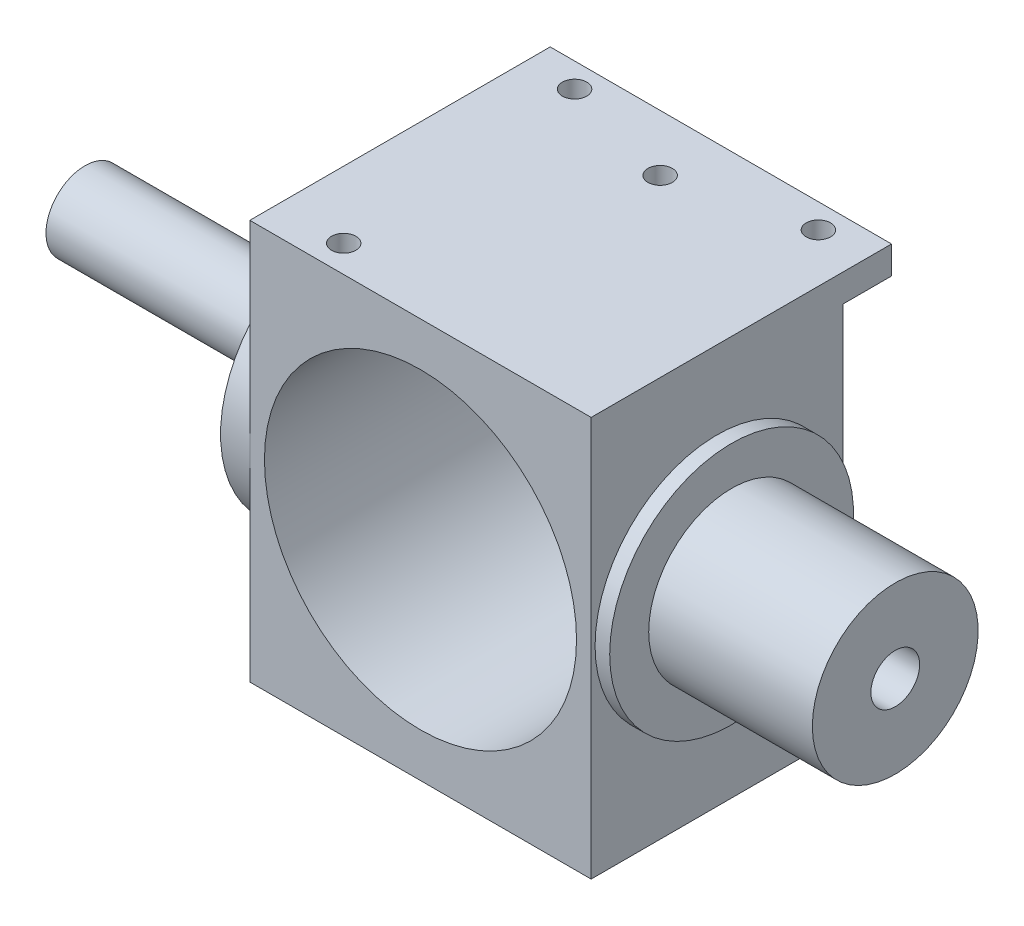
from build123d import *

# Parameters (mm, degrees)
SKETCH24_W                     = 35
SKETCH24_H                     = 41
BOSS_EXTRUDE2_DEPTH            = 30.8
SKETCH30_W                     = 5
SKETCH30_H                     = 35.1536
CUT_EXTRUDE2_DEPTH             = 96.268509944
SKETCH38_W                     = 16
SKETCH38_H                     = 30.8
F_10_START                     = 35.298543859
F_10_CLEARANCE_HOLE2_OUTLINE_R = 2.5
F_10_CLEARANCE_HOLE2_DEPTH     = 18.2822
SKETCH42_W                     = 1.25
SKETCH42_H                     = 20.5
SKETCH44_W                     = 1.25
SKETCH44_H                     = 20.5
SKETCH46_W                     = 1.25
SKETCH46_H                     = 2.8464
F_2_CLEARANCE_HOLE7_AT_2_COUNT = 2
F_2_CLEARANCE_HOLE7_AT_2_PITCH = 25
SKETCH48_W                     = 1.25
SKETCH48_H                     = 3
F_2_CLEARANCE_HOLE8_AT_2_COUNT = 2
F_2_CLEARANCE_HOLE8_AT_2_PITCH = 25


# Read off the part's stored shape, not the designer's step: #10 Clearance Hole2
with BuildPart() as part:
    # Sketch19 → Revolve2 (revolve)
    with BuildSketch(Plane.XY.offset(37.712926777)):
        Polygon((-29.500456141, 31.618402197), (-29.500456141, 27.618402197), (0.299543859, 27.618402197), (0.299543859, 40.518402197), (-2.700456141, 40.518402197), (-2.700456141, 33.118402196), (-4.200456141, 31.618402197), align=None)
    revolve(axis=Axis((-29.500456141, 27.618402197, 37.712926777), (1, 0, 0)))


with BuildPart() as body_2:
    # Sketch24 → Boss-Extrude2 (new body)
    with BuildSketch(Plane(origin=(0, 0, 19.812926777), x_dir=(-1, 0, 0), z_dir=(0, 0, -1))):
        with Locations((-17.799543859, 27.618402197)):
            Rectangle(SKETCH24_W, SKETCH24_H)
    extrude(amount=-BOSS_EXTRUDE2_DEPTH)

    # Sketch30 → Cut-Extrude2 (cut, through all)
    with BuildSketch(Plane(origin=(35.299543859, 0, 0), x_dir=(0, 0, -1), z_dir=(1, 0, 0))):
        with Locations((-22.312926777, 27.695202197)):
            Rectangle(SKETCH30_W, SKETCH30_H)
    extrude(amount=-CUT_EXTRUDE2_DEPTH, mode=Mode.SUBTRACT)

    # Sketch38 → Hole2 (revolve, cut)
    with BuildSketch(Plane(origin=(17.799543859, 27.618402197, 50.612926777), x_dir=(0, -1, 0), z_dir=(1, 0, 0))):
        with Locations((8, 15.4)):
            Rectangle(SKETCH38_W, SKETCH38_H)
    revolve(axis=Axis((17.799543859, 27.618402197, -59.387073223), (0, 0, 1)), mode=Mode.SUBTRACT)


with BuildPart() as body_3:
    # Sketch37 → Revolve3 (revolve)
    with BuildSketch(Plane(origin=(0, 0, 37.712926777), x_dir=(-1, 0, 0), z_dir=(0, 0, -1)), mode=Mode.PRIVATE) as revolve3_sk:
        Polygon((-53.580743859, 36.118402197), (-53.580743859, 27.618402197), (-35.299543859, 27.618402197), (-35.299543859, 40.118402197), (-36.799543859, 40.118402197), (-36.799543859, 36.118402197), align=None)
    revolve(revolve3_sk.sketch.rotate(Axis((53.580743859, 27.618402197, 37.712926777), (-1, 0, 0)), 270), axis=Axis((53.580743859, 27.618402197, 37.712926777), (-1, 0, 0)))


with BuildPart() as f_10_clearance_hole2_tool:
    # #10 Clearance Hole2 outline → #10 Clearance Hole2 (new body)
    with BuildSketch(Plane.YZ.offset(F_10_START)):
        with Locations((27.618402197, 37.712926777)):
            Circle(F_10_CLEARANCE_HOLE2_OUTLINE_R)
    extrude(amount=F_10_CLEARANCE_HOLE2_DEPTH)


with BuildPart() as body_2_1:
    add(body_2.part)

    # #10 Clearance Hole2: cut by f_10_clearance_hole2_tool
    add(f_10_clearance_hole2_tool.part, mode=Mode.SUBTRACT)

    # Sketch42 → #2 Clearance Hole5 (revolve, cut)
    with BuildSketch(Plane(origin=(7.149543859, 48.118402197, 47.837926777), x_dir=(0, 0, 1), z_dir=(1, 0, 0))):
        with Locations((0.625, 10.25)):
            Rectangle(SKETCH42_W, SKETCH42_H)
    revolve(axis=Axis((7.149543859, 54.468402197, 47.837926777), (0, -1, 0)), mode=Mode.SUBTRACT)

    # Sketch44 → #2 Clearance Hole6 (revolve, cut)
    with BuildSketch(Plane(origin=(17.349543859, 48.118402197, 25.587926777), x_dir=(0, 0, 1), z_dir=(1, 0, 0))):
        with Locations((0.625, 10.25)):
            Rectangle(SKETCH44_W, SKETCH44_H)
    revolve(axis=Axis((17.349543859, 54.468402197, 25.587926777), (0, -1, 0)), mode=Mode.SUBTRACT)

    # Sketch46 → #2 Clearance Hole7 (revolve, cut)
    with BuildSketch(Plane(origin=(5.299543859, 45.272002197, 22.312926777), x_dir=(0, 0, -1), z_dir=(1, 0, 0))):
        with Locations((0.625, 1.4232)):
            Rectangle(SKETCH46_W, SKETCH46_H)
    f_2_clearance_hole7 = revolve(axis=Axis((5.299543859, 38.922002197, 22.312926777), (0, 1, 0)), mode=Mode.SUBTRACT)

    # #2 Clearance Hole7 at 2: #2 Clearance Hole7 ×2
    with Locations(*[(i * F_2_CLEARANCE_HOLE7_AT_2_PITCH, 0, 0) for i in range(1, F_2_CLEARANCE_HOLE7_AT_2_COUNT)]):
        add(f_2_clearance_hole7, mode=Mode.SUBTRACT)

    # Sketch48 → #2 Clearance Hole8 (revolve, cut)
    with BuildSketch(Plane(origin=(5.299543859, 10.118402197, 22.312926777), x_dir=(0, 0, 1), z_dir=(1, 0, 0))):
        with Locations((0.625, 1.5)):
            Rectangle(SKETCH48_W, SKETCH48_H)
    f_2_clearance_hole8 = revolve(axis=Axis((5.299543859, 16.468402197, 22.312926777), (0, -1, 0)), mode=Mode.SUBTRACT)

    # #2 Clearance Hole8 at 2: #2 Clearance Hole8 ×2
    with Locations(*[(i * F_2_CLEARANCE_HOLE8_AT_2_PITCH, 0, 0) for i in range(1, F_2_CLEARANCE_HOLE8_AT_2_COUNT)]):
        add(f_2_clearance_hole8, mode=Mode.SUBTRACT)


with BuildPart() as body_3_1:
    add(body_3.part)

    # #10 Clearance Hole2: cut by f_10_clearance_hole2_tool
    add(f_10_clearance_hole2_tool.part, mode=Mode.SUBTRACT)


solid = Compound([part.part, body_2_1.part, body_3_1.part])
